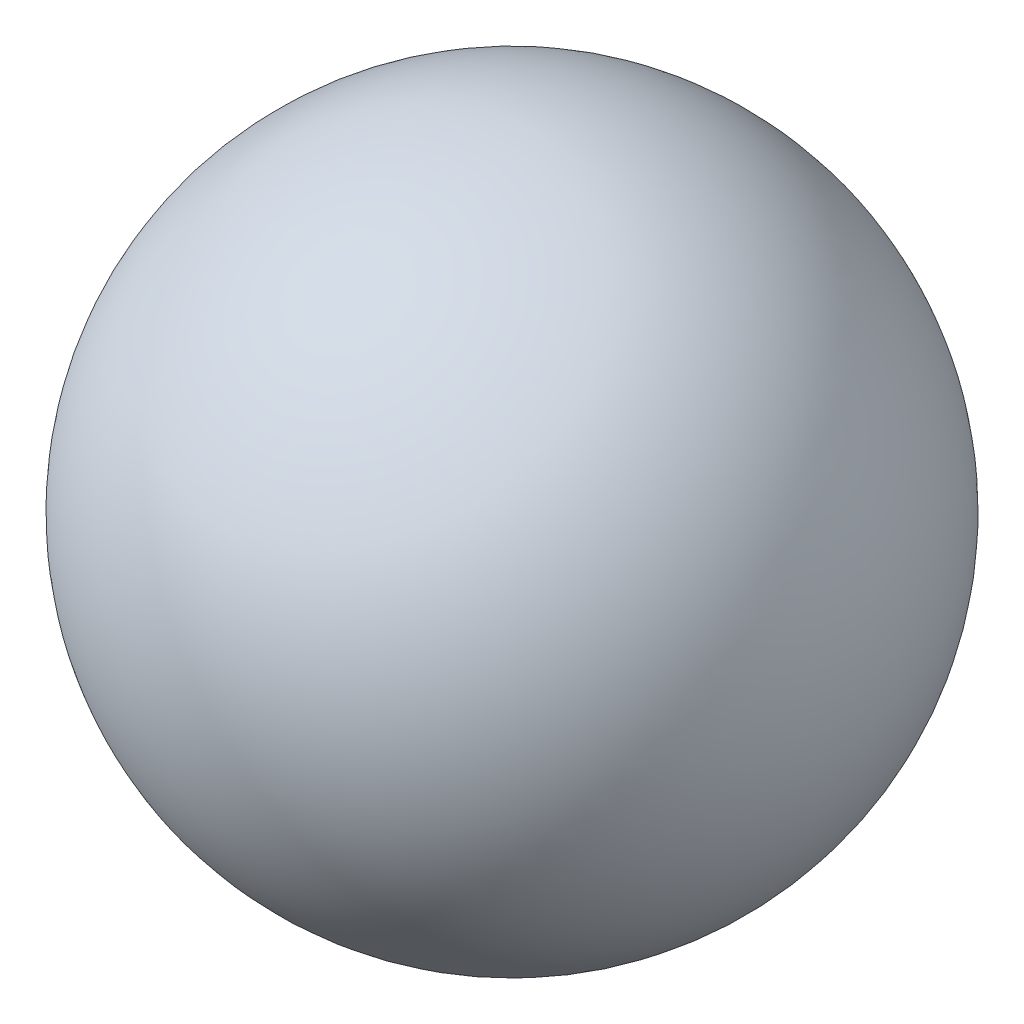
from build123d import *


with BuildPart() as part:
    # Sketch1 → Revolve1 (revolve)
    with BuildSketch(Plane(origin=(0, 0, 0), x_dir=(1, 0, 0), z_dir=(0, 1, 0))):
        with BuildLine():
            Line((0, -140), (0, -260))
            ThreePointArc((0, -260), (260, 0), (0, 260))
            Line((0, 260), (0, 140))
            ThreePointArc((0, 140), (140, 0), (0, -140))
        make_face()
    revolve(axis=Axis((0, 0, 260), (0, 0, -1)))


solid = part.part
